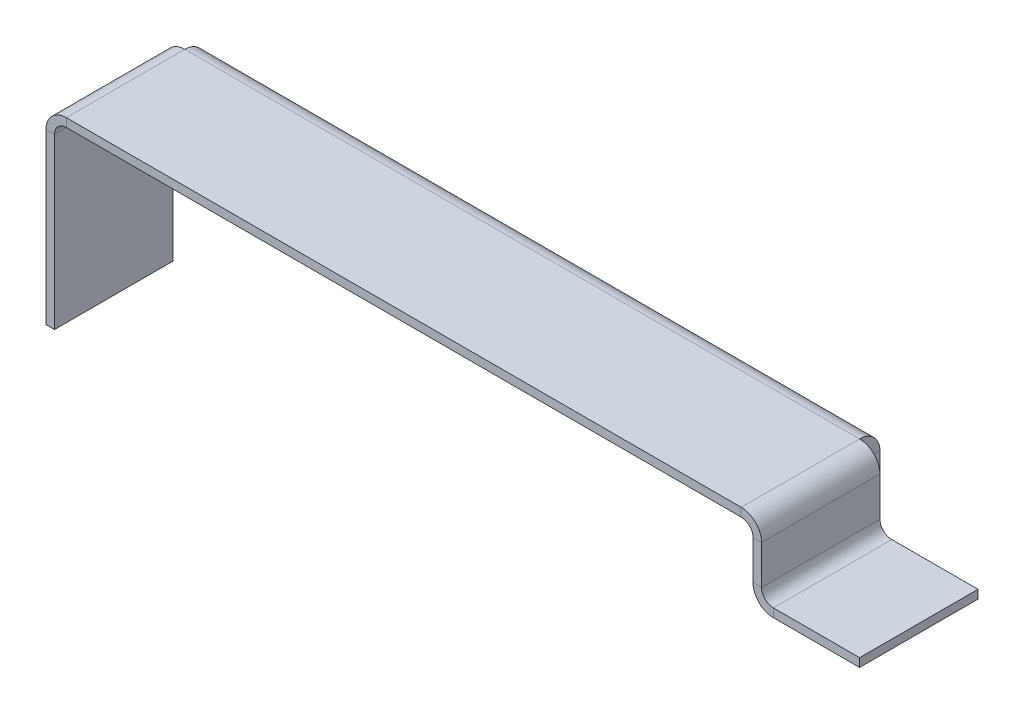
from build123d import *

# Parameters (mm, degrees)
SKETCH1_W          = 72.39
SKETCH1_H          = 12.7
BASE_FLANGE1_DEPTH = 0.91186
EDGE_FLANGE1_DEPTH = 12.7
EDGE_FLANGE2_DEPTH = 12.7
EDGE_FLANGE3_DEPTH = 12.7
EDGE_FLANGE4_DEPTH = 72.39


# Sheet-metal steps are written as plain solids
with BuildPart() as part:
    # Sketch1 → Base-Flange1 (new body)
    with BuildSketch(Plane(origin=(0, 0, 0), x_dir=(1, 0, 0), z_dir=(0, 1, 0))):
        with Locations((36.195, 6.35)):
            Rectangle(SKETCH1_W, SKETCH1_H)
    extrude(amount=-BASE_FLANGE1_DEPTH)

    # Edge-Flange1 section (across the edge) → Edge-Flange1 (add)
    with BuildSketch(Plane(origin=(-1.27, -0.91186, 0), x_dir=(1, 0, 0), z_dir=(0, 0, -1))):
        with BuildLine():
            Line((-0.91186, 1.27), (-0.91186, 19.40814))
            Line((-0.91186, 19.40814), (0, 19.40814))
            Line((0, 19.40814), (0, 1.27))
            ThreePointArc((0, 1.27), (0.371974388, 0.371974388), (1.27, 0))
            Line((1.27, 0), (1.27, -0.91186))
            ThreePointArc((1.27, -0.91186), (-0.272808002, -0.272808002), (-0.91186, 1.27))
        make_face()
    extrude(amount=EDGE_FLANGE1_DEPTH)

    # Edge-Flange2 section (across the edge) → Edge-Flange2 (add)
    with BuildSketch(Plane(origin=(73.66, -0.91186, -12.7), x_dir=(-1, 0, 0), z_dir=(0, 0, 1))):
        with BuildLine():
            Line((-0.91186, 1.27), (-0.91186, 5.43814))
            Line((-0.91186, 5.43814), (0, 5.43814))
            Line((0, 5.43814), (0, 1.27))
            ThreePointArc((0, 1.27), (0.371974388, 0.371974388), (1.27, 0))
            Line((1.27, 0), (1.27, -0.91186))
            ThreePointArc((1.27, -0.91186), (-0.272808002, -0.272808002), (-0.91186, 1.27))
        make_face()
    extrude(amount=EDGE_FLANGE2_DEPTH)

    # Edge-Flange3 section (across the edge) → Edge-Flange3 (add)
    with BuildSketch(Plane(origin=(74.57186, -7.62, 0), x_dir=(0, 1, 0), z_dir=(0, 0, -1))):
        with BuildLine():
            Line((-0.91186, 1.27), (-0.91186, 10.51814))
            Line((-0.91186, 10.51814), (0, 10.51814))
            Line((0, 10.51814), (0, 1.27))
            ThreePointArc((0, 1.27), (0.371974388, 0.371974388), (1.27, 0))
            Line((1.27, 0), (1.27, -0.91186))
            ThreePointArc((1.27, -0.91186), (-0.272808002, -0.272808002), (-0.91186, 1.27))
        make_face()
    extrude(amount=EDGE_FLANGE3_DEPTH)

    # Edge-Flange4 section (across the edge) → Edge-Flange4 (add)
    with BuildSketch(Plane(origin=(0, -0.91186, -13.97), x_dir=(0, 0, 1), z_dir=(1, 0, 0))):
        with BuildLine():
            Line((-0.91186, 1.27), (-0.91186, 5.43814))
            Line((-0.91186, 5.43814), (0, 5.43814))
            Line((0, 5.43814), (0, 1.27))
            ThreePointArc((0, 1.27), (0.371974388, 0.371974388), (1.27, 0))
            Line((1.27, 0), (1.27, -0.91186))
            ThreePointArc((1.27, -0.91186), (-0.272808002, -0.272808002), (-0.91186, 1.27))
        make_face()
    extrude(amount=EDGE_FLANGE4_DEPTH)


solid = part.part
